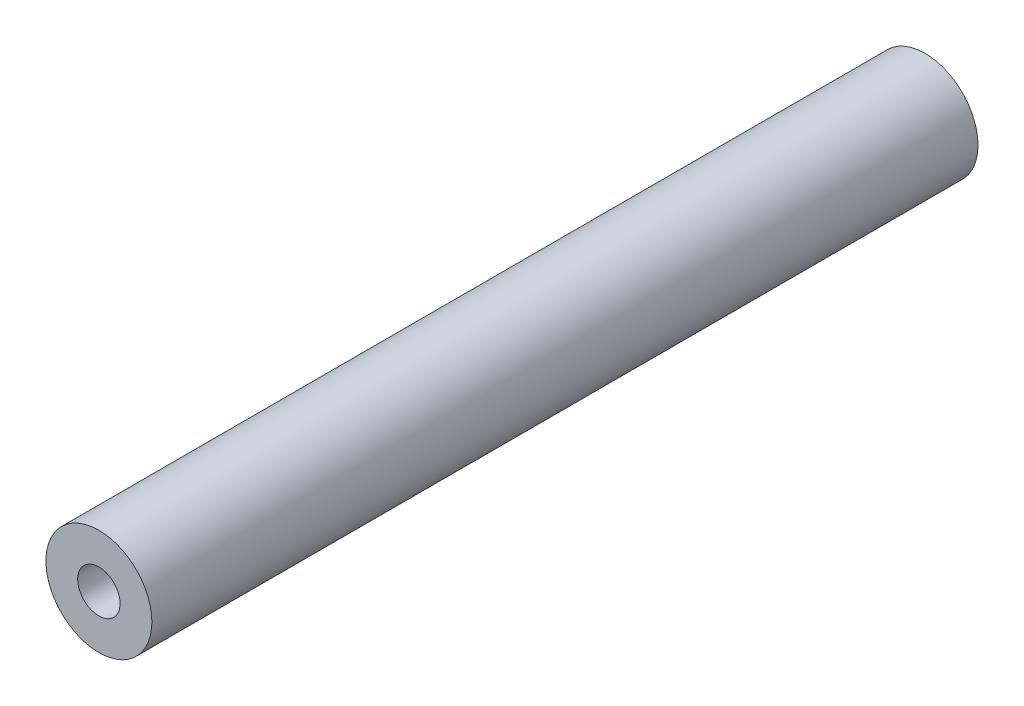
from build123d import *

# Parameters (mm, degrees)
CROQUIS2_R              = 5
SALIENTE_EXTRUIR1_DEPTH = 77.95
CROQUIS4_R              = 2
CORTAR_EXTRUIR1_DEPTH   = 10
CORTAR_EXTRUIR2_START   = -10
CROQUIS5_R              = 2
CORTAR_EXTRUIR2_DEPTH   = 10


with BuildPart() as part:
    # Croquis2 → Saliente-Extruir1 (new body)
    with BuildSketch(Plane.XY):
        Circle(CROQUIS2_R)
    extrude(amount=SALIENTE_EXTRUIR1_DEPTH)

    # Croquis4 → Cortar-Extruir1 (cut)
    with BuildSketch(Plane.XY.offset(77.95)):
        Circle(CROQUIS4_R)
    extrude(amount=-CORTAR_EXTRUIR1_DEPTH, mode=Mode.SUBTRACT)

    # Croquis5 → Cortar-Extruir2 (cut)
    with BuildSketch(Plane(origin=(0, 0, 0), x_dir=(-1, 0, 0), z_dir=(0, 0, -1)).offset(CORTAR_EXTRUIR2_START)):
        Circle(CROQUIS5_R)
    extrude(amount=CORTAR_EXTRUIR2_DEPTH, mode=Mode.SUBTRACT)


solid = part.part
